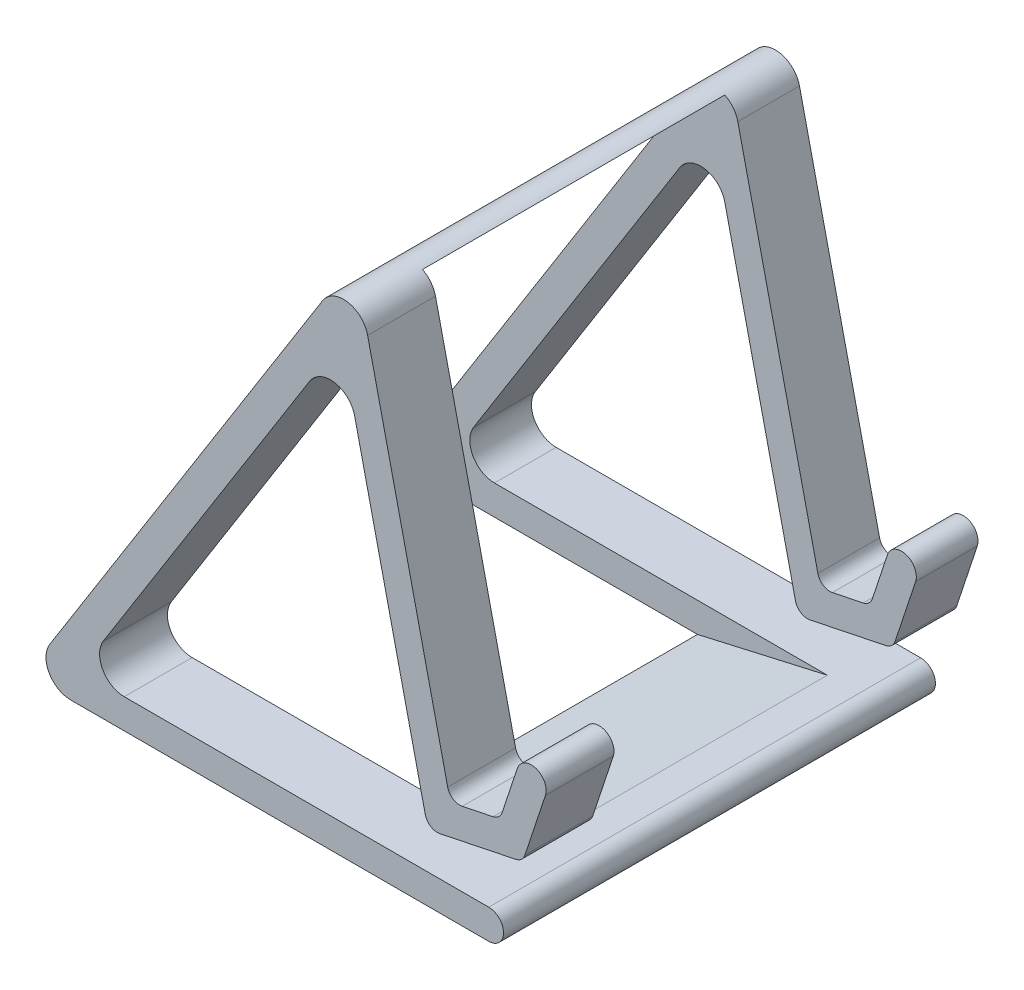
from build123d import *

# Parameters (mm, degrees)
BOSS_EXTRUDE1_DEPTH     = 3.5
CUT_EXTRUDE1_DEPTH      = 14.97650433
CUT_EXTRUDE1_DEPTH_BACK = 14.97650433
SKETCH3_W               = 4.9
SKETCH3_H               = 7.5


with BuildPart() as part:
    # Sketch1 → Boss-Extrude1 (new, symmetric)
    with BuildSketch(Plane.XY):
        with BuildLine():
            Line((-38.278053011, -20.798244063), (-31.502008013, -20.798244063))
            ThreePointArc((-31.502008013, -20.798244063), (-31.262008013, -20.558244063), (-31.502008013, -20.318244063))
            Line((-31.502008013, -20.318244063), (-37.409307008, -20.318244063))
            ThreePointArc((-37.409307008, -20.318244063), (-37.75942008, -20.111688723), (-37.747944529, -19.705348245))
            Line((-37.747944529, -19.705348245), (-34.40399467, -14.386376273))
            ThreePointArc((-34.40399467, -14.386376273), (-33.998258029, -14.204940114), (-33.675364185, -14.51035928))
            Line((-33.675364185, -14.51035928), (-32.530616035, -19.531499889))
            ThreePointArc((-32.530616035, -19.531499889), (-32.443745069, -19.655295892), (-32.295047892, -19.682885105))
            Line((-32.295047892, -19.682885105), (-31.065018843, -19.428065307))
            ThreePointArc((-31.065018843, -19.428065307), (-30.972533604, -19.381541674), (-30.915700855, -19.295008407))
            Line((-30.915700855, -19.295008407), (-30.583910328, -18.291522431))
            ThreePointArc((-30.583910328, -18.291522431), (-30.736436242, -17.988313187), (-31.039645486, -18.140839101))
            Line((-31.039645486, -18.140839101), (-31.284438952, -18.881206261))
            ThreePointArc((-31.284438952, -18.881206261), (-31.341271701, -18.967739528), (-31.433756939, -19.014263161))
            Line((-31.433756939, -19.014263161), (-31.93165158, -19.11740984))
            ThreePointArc((-31.93165158, -19.11740984), (-32.080348757, -19.089820628), (-32.167219723, -18.966024625))
            Line((-32.167219723, -18.966024625), (-33.464958044, -13.273832343))
            ThreePointArc((-33.464958044, -13.273832343), (-33.787851888, -12.968413177), (-34.193588529, -13.149849336))
            Line((-34.193588529, -13.149849336), (-38.616690532, -20.185348245))
            ThreePointArc((-38.616690532, -20.185348245), (-38.628166083, -20.591688723), (-38.278053011, -20.798244063))
        make_face()
    extrude(amount=BOSS_EXTRUDE1_DEPTH, both=True)

    # Sketch3 → Cut-Extrude1 (cut, two sides: drawn at the far end of the back side and taken through both)
    with BuildSketch(Plane(origin=(-34.688197011, -7.908412139, 0), x_dir=(0, 0, -1), z_dir=(0.974982410436755, 0.22228202657645335, 0)).offset(-CUT_EXTRUDE1_DEPTH_BACK)):
        with Locations((0.05, -8.944039053)):
            Rectangle(SKETCH3_W, SKETCH3_H)
    extrude(amount=CUT_EXTRUDE1_DEPTH + CUT_EXTRUDE1_DEPTH_BACK, mode=Mode.SUBTRACT)


solid = part.part
